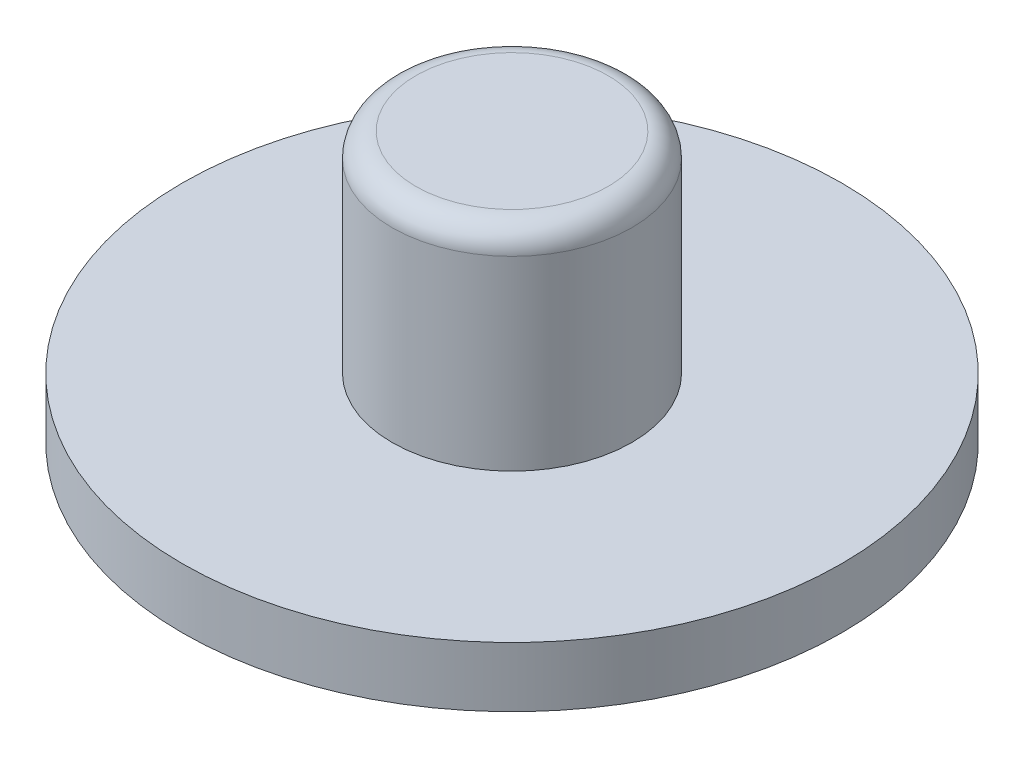
from build123d import *

# Parameters (mm, degrees)
SKETCH1_R           = 4
BOSS_EXTRUDE1_DEPTH = 3.5
FILLET1_R           = 0.79375
SKETCH2_R           = 11
BOSS_EXTRUDE2_DEPTH = 2


with BuildPart() as part:
    # Sketch1 → Boss-Extrude1 (new, symmetric)
    with BuildSketch(Plane(origin=(0, 0, 0), x_dir=(1, 0, 0), z_dir=(0, 1, 0))):
        Circle(SKETCH1_R)
    extrude(amount=BOSS_EXTRUDE1_DEPTH, both=True)

    # Fillet1
    fillet1_edges = [part.edges().sort_by_distance(p)[0] for p in [
        (-4, 3.5, 0),
    ]]
    fillet(fillet1_edges, radius=FILLET1_R)

    # Sketch2 → Boss-Extrude2 (add)
    with BuildSketch(Plane.XZ.offset(3.5)):
        Circle(SKETCH2_R)
    extrude(amount=BOSS_EXTRUDE2_DEPTH)


solid = part.part
